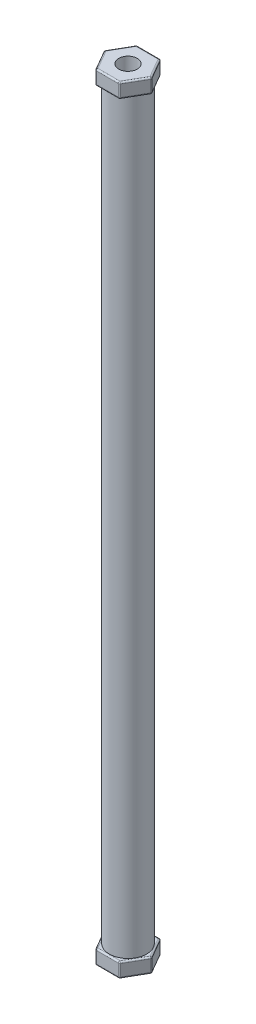
from build123d import *

# Parameters (mm, degrees)
SKETCH1_R            = 6.35
SKETCH1_R_2          = 3.175
BOSS_EXTRUDE1_DEPTH  = 254
SKETCH2_R            = 3.175
BOSS_EXTRUDE2_DEPTH  = 5
FILLET1_R            = 0.5
FILLET1_OF_MIRROR1_R = 0.5


with BuildPart() as part:
    # Sketch1 → Boss-Extrude1 (new body)
    with BuildSketch(Plane(origin=(0, 0, 0), x_dir=(1, 0, 0), z_dir=(0, 1, 0))):
        Circle(SKETCH1_R)
        Circle(SKETCH1_R_2, mode=Mode.SUBTRACT)
    extrude(amount=BOSS_EXTRUDE1_DEPTH)

    # Sketch2 → Boss-Extrude2 (add)
    with BuildSketch(Plane(origin=(0, 254, 0), x_dir=(1, 0, 0), z_dir=(0, 1, 0))):
        Polygon((-8.065583261, 0), (-4.03279163, -6.985), (4.03279163, -6.985), (8.065583261, 0), (4.03279163, 6.985), (-4.03279163, 6.985), align=None)
        Circle(SKETCH2_R, mode=Mode.SUBTRACT)
    boss_extrude2 = extrude(amount=BOSS_EXTRUDE2_DEPTH)

    # Fillet1
    fillet1_edges = [part.edges().sort_by_distance(p)[0] for p in [
        (6.049187445, 254, -3.4925),
        (4.03279163, 256.5, -6.985),
        (8.065583261, 256.5, 0),
        (-4.03279163, 256.5, -6.985),
        (-6.049187445, 254, -3.4925),
        (-8.065583261, 256.5, 0),
        (-6.049187445, 254, 3.4925),
        (-4.03279163, 256.5, 6.985),
        (0, 254, 6.985),
        (6.049187445, 254, 3.4925),
        (4.03279163, 256.5, 6.985),
        (6.049187445, 259, 3.4925),
        (6.049187445, 259, -3.4925),
        (0, 259, -6.985),
        (-6.049187445, 259, -3.4925),
        (-6.049187445, 259, 3.4925),
        (0, 259, 6.985),
        (0, 254, -6.985),
    ]]
    fillet(fillet1_edges, radius=FILLET1_R)

    # Mirror1: Boss-Extrude2 across plane
    add(boss_extrude2.mirror(Plane.ZX.offset(127)))

    # Fillet1 of Mirror1
    fillet1_of_mirror1_edges = [part.edges().sort_by_distance(p)[0] for p in [
        (6.049187445, 0, -3.4925),
        (4.03279163, -2.5, -6.985),
        (8.065583261, -2.5, 0),
        (-4.03279163, -2.5, -6.985),
        (-6.049187445, 0, -3.4925),
        (-8.065583261, -2.5, 0),
        (-6.049187445, 0, 3.4925),
        (-4.03279163, -2.5, 6.985),
        (0, 0, 6.985),
        (6.049187445, 0, 3.4925),
        (4.03279163, -2.5, 6.985),
        (6.049187445, -5, 3.4925),
        (6.049187445, -5, -3.4925),
        (0, -5, -6.985),
        (-6.049187445, -5, -3.4925),
        (-6.049187445, -5, 3.4925),
        (0, -5, 6.985),
        (0, 0, -6.985),
    ]]
    fillet(fillet1_of_mirror1_edges, radius=FILLET1_OF_MIRROR1_R)


solid = part.part
